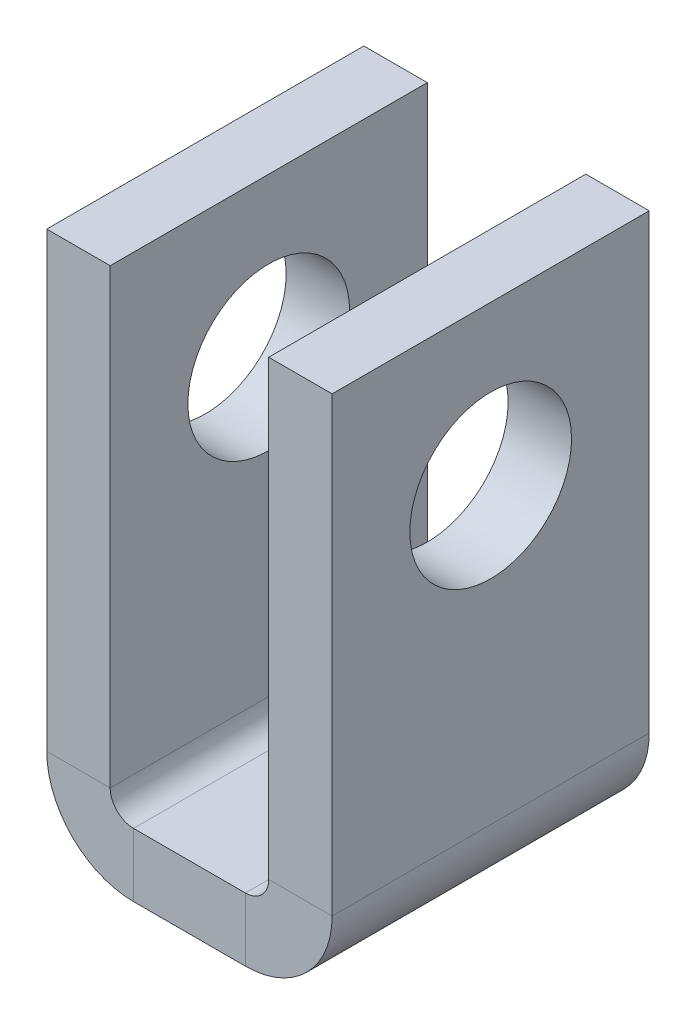
from build123d import *

# Parameters (mm, degrees)
BASE_FLANGE1_DEPTH = 10
SKETCH6_R          = 2.55
CUT_EXTRUDE1_DEPTH = 21.14944168


# Sheet-metal steps are written as plain solids
with BuildPart() as part:
    # Sketch1 → Base-Flange1 (new body)
    with BuildSketch(Plane.XY):
        with BuildLine():
            Line((0, 15), (0, 0.7366))
            ThreePointArc((0, 0.7366), (0.215745145, 0.215745145), (0.7366, 0))
            Line((0.7366, 0), (4.2634, 0))
            ThreePointArc((4.2634, 0), (4.784254855, 0.215745145), (5, 0.7366))
            Line((5, 0.7366), (5, 15))
            Line((5, 15), (7, 15))
            Line((7, 15), (7, 0.7366))
            ThreePointArc((7, 0.7366), (6.198468417, -1.198468417), (4.2634, -2))
            Line((4.2634, -2), (0.7366, -2))
            ThreePointArc((0.7366, -2), (-1.198468417, -1.198468417), (-2, 0.7366))
            Line((-2, 0.7366), (-2, 15))
            Line((-2, 15), (0, 15))
        make_face()
    extrude(amount=BASE_FLANGE1_DEPTH)

    # Sketch6 → Cut-Extrude1 (cut, through all)
    with BuildSketch(Plane.ZY.offset(2)):
        with Locations((5, 10)):
            Circle(SKETCH6_R)
    extrude(amount=-CUT_EXTRUDE1_DEPTH, mode=Mode.SUBTRACT)


solid = part.part
